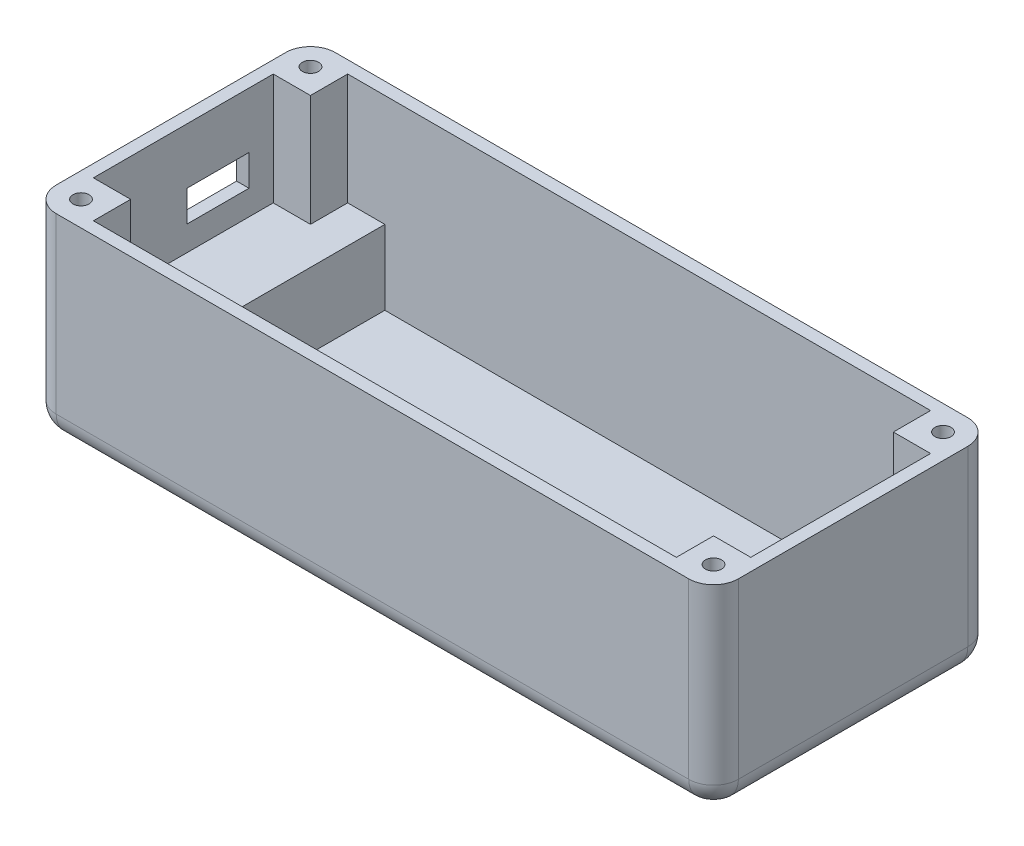
from build123d import *

# Parameters (mm, degrees)
SKETCH1_W           = 110
SKETCH1_H           = 45
BOSS_EXTRUDE1_DEPTH = 2
SKETCH3_W           = 110
SKETCH3_H           = 45
SKETCH3_W_2         = 106
SKETCH3_H_2         = 41
BOSS_EXTRUDE2_DEPTH = 30
SKETCH4_W           = 12
SKETCH4_H           = 41
BOSS_EXTRUDE3_DEPTH = 12
SKETCH5_W           = 6
SKETCH5_H           = 6
BOSS_EXTRUDE4_DEPTH = 18
SKETCH6_W           = 6
SKETCH6_H           = 6
BOSS_EXTRUDE5_DEPTH = 18
FILLET1_R           = 4
FILLET2_R           = 4
SKETCH7_R           = 1.3
CUT_EXTRUDE1_DEPTH  = 34
SKETCH8_R           = 2.9
CUT_EXTRUDE2_DEPTH  = 25
SKETCH9_W           = 10
SKETCH9_H           = 20
CUT_EXTRUDE3_DEPTH  = 10
SKETCH10_W          = 10
SKETCH10_H          = 5
CUT_EXTRUDE4_DEPTH  = 10


with BuildPart() as part:
    # Sketch1 → Boss-Extrude1 (new body)
    with BuildSketch(Plane(origin=(0, 0, 0), x_dir=(1, 0, 0), z_dir=(0, 1, 0))):
        Rectangle(SKETCH1_W, SKETCH1_H)
    extrude(amount=BOSS_EXTRUDE1_DEPTH)

    # Sketch3 → Boss-Extrude2 (add)
    with BuildSketch(Plane(origin=(0, 2, 0), x_dir=(1, 0, 0), z_dir=(0, 1, 0))):
        Rectangle(SKETCH3_W, SKETCH3_H)
        Rectangle(SKETCH3_W_2, SKETCH3_H_2, mode=Mode.SUBTRACT)
    extrude(amount=BOSS_EXTRUDE2_DEPTH)

    # Sketch4 → Boss-Extrude3 (add)
    with BuildSketch(Plane(origin=(0, 2, 0), x_dir=(1, 0, 0), z_dir=(0, 1, 0))):
        with Locations((-47, 0)):
            Rectangle(SKETCH4_W, SKETCH4_H)
        with Locations((47, 0)):
            Rectangle(SKETCH4_W, SKETCH4_H)
    extrude(amount=BOSS_EXTRUDE3_DEPTH)

    # Sketch5 → Boss-Extrude4 (add)
    with BuildSketch(Plane(origin=(0, 14, 0), x_dir=(1, 0, 0), z_dir=(0, 1, 0))):
        with Locations((-50, 17.5)):
            Rectangle(SKETCH5_W, SKETCH5_H)
        with Locations((-50, -17.5)):
            Rectangle(SKETCH5_W, SKETCH5_H)
    extrude(amount=BOSS_EXTRUDE4_DEPTH)

    # Sketch6 → Boss-Extrude5 (add)
    with BuildSketch(Plane(origin=(0, 14, 0), x_dir=(1, 0, 0), z_dir=(0, 1, 0))):
        with Locations((50, 17.5)):
            Rectangle(SKETCH6_W, SKETCH6_H)
        with Locations((50, -17.5)):
            Rectangle(SKETCH6_W, SKETCH6_H)
    extrude(amount=BOSS_EXTRUDE5_DEPTH)

    # Fillet1
    fillet1_edges = [part.edges().sort_by_distance(p)[0] for p in [
        (55, 16, -22.5),
        (55, 16, 22.5),
        (-55, 16, 22.5),
        (-55, 16, -22.5),
    ]]
    fillet(fillet1_edges, radius=FILLET1_R)

    # Fillet2
    fillet2_edges = [part.edges().sort_by_distance(p)[0] for p in [
        (53.828427125, 0, 21.328427125),
        (53.828427125, 0, -21.328427125),
        (55, 0, 0),
        (-53.828427125, 0, 21.328427125),
        (0, 0, 22.5),
        (-53.828427125, 0, -21.328427125),
        (-55, 0, 0),
        (0, 0, -22.5),
    ]]
    fillet(fillet2_edges, radius=FILLET2_R)

    # Sketch7 → Cut-Extrude1 (cut)
    with BuildSketch(Plane(origin=(0, 32, 0), x_dir=(1, 0, 0), z_dir=(0, 1, 0))):
        with Locations((-51, 18.5)):
            Circle(SKETCH7_R)
        with Locations((51, 18.5)):
            Circle(SKETCH7_R)
        with Locations((51, -18.5)):
            Circle(SKETCH7_R)
        with Locations((-51, -18.5)):
            Circle(SKETCH7_R)
    extrude(amount=-CUT_EXTRUDE1_DEPTH, mode=Mode.SUBTRACT)

    # Sketch8 → Cut-Extrude2 (cut)
    with BuildSketch(Plane.XZ):
        with Locations((-51, 18.5)):
            Circle(SKETCH8_R)
        with Locations((-51, -18.5)):
            Circle(SKETCH8_R)
        with Locations((51, -18.5)):
            Circle(SKETCH8_R)
        with Locations((51, 18.5)):
            Circle(SKETCH8_R)
    extrude(amount=-CUT_EXTRUDE2_DEPTH, mode=Mode.SUBTRACT)

    # Sketch9 → Cut-Extrude3 (cut)
    with BuildSketch(Plane(origin=(0, 2, 0), x_dir=(1, 0, 0), z_dir=(0, 1, 0))):
        with Locations((36, 0)):
            Rectangle(SKETCH9_W, SKETCH9_H)
    extrude(amount=-CUT_EXTRUDE3_DEPTH, mode=Mode.SUBTRACT)

    # Sketch10 → Cut-Extrude4 (cut)
    with BuildSketch(Plane(origin=(-53, 0, 0), x_dir=(0, 0, -1), z_dir=(1, 0, 0))):
        with Locations((5.585873518, 20.5)):
            Rectangle(SKETCH10_W, SKETCH10_H)
    extrude(amount=-CUT_EXTRUDE4_DEPTH, mode=Mode.SUBTRACT)


solid = part.part
